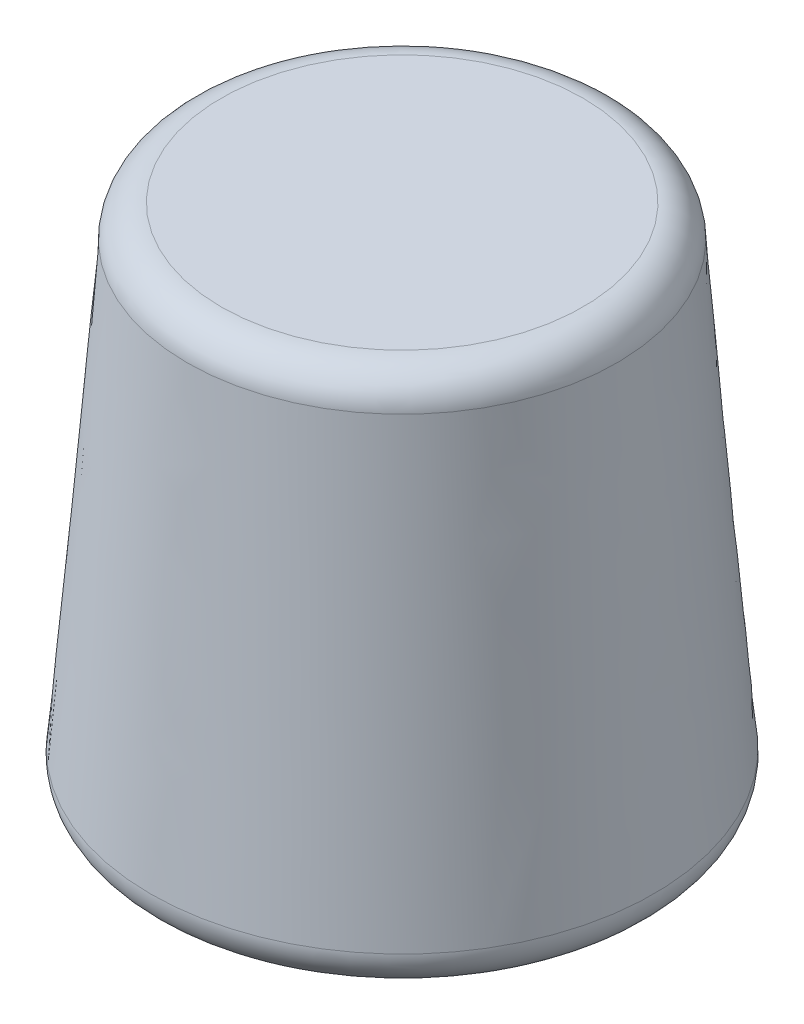
from build123d import *

# Parameters (mm, degrees)
FILLET1_R = 2.54


with BuildPart() as part:
    # Loft1: read off the stored shape, not the designer's step
    # Loft1: loft between two sections, ruled curve by curve
    loft1_from = [
        Edge.make_bspline([(16.409308574, 0, 9.676626071), (35.762560715, 0, -23.141991078), (2.943943567, 0, -42.495243219), (-16.409308574, 0, -9.676626071), (-35.762560715, 0, 23.141991078), (-2.943943567, 0, 42.495243219), (16.409308574, 0, 9.676626071)], [0, 0, 0, 0, 0.5, 0.5, 0.5, 1, 1, 1, 1], 3, [1, 0.333333333, 0.333333333, 1, 0.333333333, 0.333333333, 1]),
    ]
    loft1_to = [
        Edge.make_bspline([(11.681039208, 38.1, 10.750299904), (33.181639016, 38.1, -12.611778512), (9.8195606, 38.1, -34.11237832), (-11.681039208, 38.1, -10.750299904), (-33.181639016, 38.1, 12.611778512), (-9.8195606, 38.1, 34.11237832), (11.681039208, 38.1, 10.750299904)], [0, 0, 0, 0, 0.5, 0.5, 0.5, 1, 1, 1, 1], 3, [1, 0.333333333, 0.333333333, 1, 0.333333333, 0.333333333, 1]),
    ]
    loft1 = Solid(Shell([*[Face.make_surface_from_curves(loft1_from[k], loft1_to[k]) for k in range(1)], Face(Wire(loft1_from)), Face(Wire(loft1_to))]))
    add(loft1)

    # Fillet1
    fillet1_edges = [part.edges().sort_by_distance(p)[0] for p in [
        (-11.681039208, 38.1, -10.750299904),
        (-16.409308574, 0, -9.676626071),
    ]]
    fillet(fillet1_edges, radius=FILLET1_R)


solid = part.part
